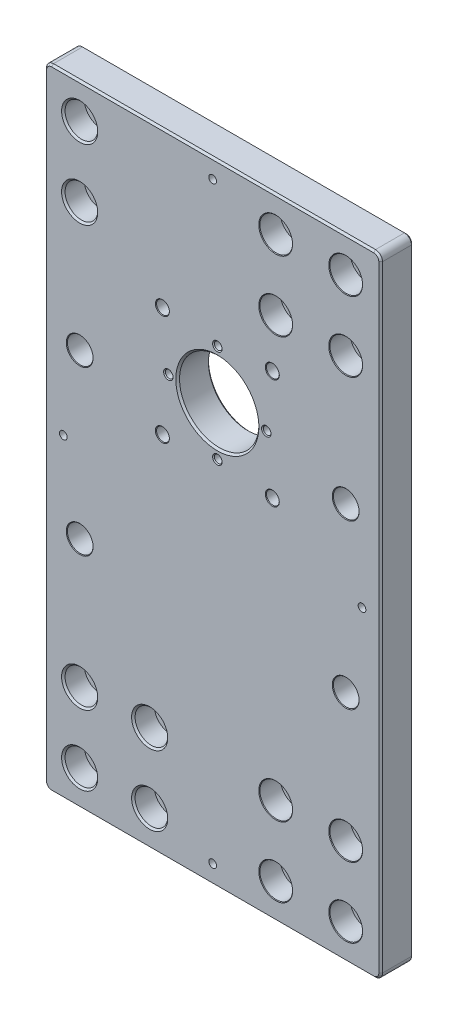
from build123d import *

# Parameters (mm, degrees)
SKETCH1_W                                     = 144
SKETCH1_H                                     = 270
SKETCH1_R                                     = 17
BASE_FLANGE1_DEPTH                            = 14
CBORE_FOR_M8_HEX_SOCKET_HEAD_CAP_SCR_2_COUNT  = 2
CBORE_FOR_M8_HEX_SOCKET_HEAD_CAP_SCR_2_PITCH  = 30
CBORE_FOR_M8_HEX_SOCKET_HEAD_CAP_SCR_3_COUNT  = 2
CBORE_FOR_M8_HEX_SOCKET_HEAD_CAP_SCR_3_PITCH  = 42.426406871
CBORE_FOR_M8_HEX_SOCKET_HEAD_CAP_SCR_4_COUNT  = 2
CBORE_FOR_M8_HEX_SOCKET_HEAD_CAP_SCR_4_PITCH  = 30
CBORE_FOR_M8_HEX_SOCKET_HEAD_CAP_SCR_5_COUNT  = 2
CBORE_FOR_M8_HEX_SOCKET_HEAD_CAP_SCR_5_PITCH  = 241.867732449
CBORE_FOR_M8_HEX_SOCKET_HEAD_CAP_SCR_6_COUNT  = 2
CBORE_FOR_M8_HEX_SOCKET_HEAD_CAP_SCR_6_PITCH  = 240
CBORE_FOR_M8_HEX_SOCKET_HEAD_CAP_SCR_7_COUNT  = 2
CBORE_FOR_M8_HEX_SOCKET_HEAD_CAP_SCR_7_PITCH  = 212.132034356
CBORE_FOR_M8_HEX_SOCKET_HEAD_CAP_SCR_8_COUNT  = 2
CBORE_FOR_M8_HEX_SOCKET_HEAD_CAP_SCR_8_PITCH  = 210
M4_TAPPED_HOLE1_D                             = 3.3
M4_TAPPED_HOLE1_CSINK_D                       = 4.05
M4_TAPPED_HOLE1_CSINK_ANGLE                   = 90
M5_CLEARANCE_HOLE1_AT_2_COUNT                 = 2
M5_CLEARANCE_HOLE1_AT_2_PITCH                 = 47.100382695
M5_CLEARANCE_HOLE1_AT_3_COUNT                 = 2
M5_CLEARANCE_HOLE1_AT_3_PITCH                 = 66.61
M5_CLEARANCE_HOLE1_AT_4_COUNT                 = 2
M5_CLEARANCE_HOLE1_AT_4_PITCH                 = 47.100382695
CBORE_FOR_M6_HEX_SOCKET_HEAD_CAP_SCR_2_COUNT  = 2
CBORE_FOR_M6_HEX_SOCKET_HEAD_CAP_SCR_2_PITCH  = 114
CRVPATTERN1_COUNT                             = 2
CRVPATTERN1_PITCH                             = 70
M4_TAPPED_HOLE2_AT_2_COUNT                    = 2
M4_TAPPED_HOLE2_AT_2_PITCH                    = 142.214626533
M4_TAPPED_HOLE2_AT_3_COUNT                    = 2
M4_TAPPED_HOLE2_AT_3_PITCH                    = 254
M4_TAPPED_HOLE2_AT_4_COUNT                    = 2
M4_TAPPED_HOLE2_AT_4_PITCH                    = 142.214626533
CBORE_FOR_M8_HEX_SOCKET_HEAD_CAP_SCR_9_COUNT  = 2
CBORE_FOR_M8_HEX_SOCKET_HEAD_CAP_SCR_9_PITCH  = 30
CBORE_FOR_M8_HEX_SOCKET_HEAD_CAP_SCR_10_COUNT = 2
CBORE_FOR_M8_HEX_SOCKET_HEAD_CAP_SCR_10_PITCH = 210
CBORE_FOR_M8_HEX_SOCKET_HEAD_CAP_SCR_11_COUNT = 2
CBORE_FOR_M8_HEX_SOCKET_HEAD_CAP_SCR_11_PITCH = 240
CBORE_FOR_M8_HEX_SOCKET_HEAD_CAP_SCR_12_COUNT = 2
CBORE_FOR_M8_HEX_SOCKET_HEAD_CAP_SCR_12_PITCH = 212.132034356
CBORE_FOR_M8_HEX_SOCKET_HEAD_CAP_SCR_13_COUNT = 2
CBORE_FOR_M8_HEX_SOCKET_HEAD_CAP_SCR_13_PITCH = 241.867732449
FILLET1_R                                     = 3
CHAMFER1_SIZE                                 = 0.8


# Sheet-metal steps are written as plain solids
with BuildPart() as part:
    # Sketch1 → Base-Flange1 (new body)
    with BuildSketch(Plane.XY):
        with Locations((-72, -135)):
            Rectangle(SKETCH1_W, SKETCH1_H)
        with Locations(Location((-70, -90, 0), (0, 0, 180))):
            Circle(SKETCH1_R, mode=Mode.SUBTRACT)
    extrude(amount=-BASE_FLANGE1_DEPTH)

    # Sketch7 → CBORE for M8 Hex Socket Head Cap Screw1 (revolve, cut)
    with BuildSketch(Plane(origin=(-45, -15, 0), x_dir=(0, -1, 0), z_dir=(1, 0, 0))):
        Polygon((0, 0), (0, 14), (4.75, 14), (4.25, 13.5), (4.25, 9), (7, 9), (7, 0.25), (7.25, 0), align=None)
    cbore_for_m8_hex_socket_head_cap_screw1 = revolve(axis=Axis((-45, -15, 6.35), (0, 0, -1)), mode=Mode.SUBTRACT)

    # CBORE for M8 Hex Socket Head Cap Scr 2: CBORE for M8 Hex Socket Head Cap Screw1 ×2
    with Locations(*[(i * CBORE_FOR_M8_HEX_SOCKET_HEAD_CAP_SCR_2_PITCH, 0, 0) for i in range(1, CBORE_FOR_M8_HEX_SOCKET_HEAD_CAP_SCR_2_COUNT)]):
        add(cbore_for_m8_hex_socket_head_cap_screw1, mode=Mode.SUBTRACT)

    # CBORE for M8 Hex Socket Head Cap Scr 3: CBORE for M8 Hex Socket Head Cap Screw1 ×2
    with Locations(*[Vector(0.7071067811865476, -0.7071067811865475, 0) * (i * CBORE_FOR_M8_HEX_SOCKET_HEAD_CAP_SCR_3_PITCH) for i in range(1, CBORE_FOR_M8_HEX_SOCKET_HEAD_CAP_SCR_3_COUNT)]):
        add(cbore_for_m8_hex_socket_head_cap_screw1, mode=Mode.SUBTRACT)

    # CBORE for M8 Hex Socket Head Cap Scr 4: CBORE for M8 Hex Socket Head Cap Screw1 ×2
    with Locations(*[(0, -i * CBORE_FOR_M8_HEX_SOCKET_HEAD_CAP_SCR_4_PITCH, 0) for i in range(1, CBORE_FOR_M8_HEX_SOCKET_HEAD_CAP_SCR_4_COUNT)]):
        add(cbore_for_m8_hex_socket_head_cap_screw1, mode=Mode.SUBTRACT)

    # CBORE for M8 Hex Socket Head Cap Scr 5: CBORE for M8 Hex Socket Head Cap Screw1 ×2
    with Locations(*[Vector(0.12403473458920848, -0.9922778767136676, 0) * (i * CBORE_FOR_M8_HEX_SOCKET_HEAD_CAP_SCR_5_PITCH) for i in range(1, CBORE_FOR_M8_HEX_SOCKET_HEAD_CAP_SCR_5_COUNT)]):
        add(cbore_for_m8_hex_socket_head_cap_screw1, mode=Mode.SUBTRACT)

    # CBORE for M8 Hex Socket Head Cap Scr 6: CBORE for M8 Hex Socket Head Cap Screw1 ×2
    with Locations(*[(0, -i * CBORE_FOR_M8_HEX_SOCKET_HEAD_CAP_SCR_6_PITCH, 0) for i in range(1, CBORE_FOR_M8_HEX_SOCKET_HEAD_CAP_SCR_6_COUNT)]):
        add(cbore_for_m8_hex_socket_head_cap_screw1, mode=Mode.SUBTRACT)

    # CBORE for M8 Hex Socket Head Cap Scr 7: CBORE for M8 Hex Socket Head Cap Screw1 ×2
    with Locations(*[Vector(0.1414213562373096, -0.9899494936611666, 0) * (i * CBORE_FOR_M8_HEX_SOCKET_HEAD_CAP_SCR_7_PITCH) for i in range(1, CBORE_FOR_M8_HEX_SOCKET_HEAD_CAP_SCR_7_COUNT)]):
        add(cbore_for_m8_hex_socket_head_cap_screw1, mode=Mode.SUBTRACT)

    # CBORE for M8 Hex Socket Head Cap Scr 8: CBORE for M8 Hex Socket Head Cap Screw1 ×2
    with Locations(*[(0, -i * CBORE_FOR_M8_HEX_SOCKET_HEAD_CAP_SCR_8_PITCH, 0) for i in range(1, CBORE_FOR_M8_HEX_SOCKET_HEAD_CAP_SCR_8_COUNT)]):
        add(cbore_for_m8_hex_socket_head_cap_screw1, mode=Mode.SUBTRACT)

    # M4 Tapped Hole1 (through all)
    with Locations(Plane.XY):
        with Locations((-91, -90), (-70, -69), (-49, -90), (-70, -111)):
            CounterSinkHole(M4_TAPPED_HOLE1_D / 2, M4_TAPPED_HOLE1_CSINK_D / 2, counter_sink_angle=M4_TAPPED_HOLE1_CSINK_ANGLE)

    # Sketch16 → M5 Clearance Hole1 (revolve, cut)
    with BuildSketch(Plane(origin=(-93.550191347, -113.550191347, 0), x_dir=(0, -1, 0), z_dir=(1, 0, 0))):
        Polygon((0, 0), (0, 14), (3, 14), (2.75, 13.75), (2.75, 0.25), (3, 0), align=None)
    m5_clearance_hole1 = revolve(axis=Axis((-93.550191347, -113.550191347, 6.35), (0, 0, -1)), mode=Mode.SUBTRACT)

    # M5 Clearance Hole1 at 2: M5 Clearance Hole1 ×2
    with Locations(*[(0, i * M5_CLEARANCE_HOLE1_AT_2_PITCH, 0) for i in range(1, M5_CLEARANCE_HOLE1_AT_2_COUNT)]):
        add(m5_clearance_hole1, mode=Mode.SUBTRACT)

    # M5 Clearance Hole1 at 3: M5 Clearance Hole1 ×2
    with Locations(*[Vector(0.707106781186551, 0.707106781186544, 0) * (i * M5_CLEARANCE_HOLE1_AT_3_PITCH) for i in range(1, M5_CLEARANCE_HOLE1_AT_3_COUNT)]):
        add(m5_clearance_hole1, mode=Mode.SUBTRACT)

    # M5 Clearance Hole1 at 4: M5 Clearance Hole1 ×2
    with Locations(*[(i * M5_CLEARANCE_HOLE1_AT_4_PITCH, 0, 0) for i in range(1, M5_CLEARANCE_HOLE1_AT_4_COUNT)]):
        add(m5_clearance_hole1, mode=Mode.SUBTRACT)

    # Sketch20 → CBORE for M6 Hex Socket Head Cap Screw1 (revolve, cut)
    with BuildSketch(Plane(origin=(-129, -100, 0), x_dir=(0, -1, 0), z_dir=(1, 0, 0))):
        Polygon((0, 0), (0, 14), (3.5, 14), (3.25, 13.75), (3.25, 8), (5.5, 8), (5.5, 0.25), (5.75, 0), align=None)
    cbore_for_m6_hex_socket_head_cap_screw1 = revolve(axis=Axis((-129, -100, 6.35), (0, 0, -1)), mode=Mode.SUBTRACT)

    # CBORE for M6 Hex Socket Head Cap Scr 2: CBORE for M6 Hex Socket Head Cap Screw1 ×2
    with Locations(*[(i * CBORE_FOR_M6_HEX_SOCKET_HEAD_CAP_SCR_2_PITCH, 0, 0) for i in range(1, CBORE_FOR_M6_HEX_SOCKET_HEAD_CAP_SCR_2_COUNT)]):
        add(cbore_for_m6_hex_socket_head_cap_screw1, mode=Mode.SUBTRACT)

    # CrvPattern1: CBORE for M6 Hex Socket Head Cap Screw1 ×2
    with Locations(*[(0, -i * CRVPATTERN1_PITCH, 0) for i in range(1, CRVPATTERN1_COUNT)]):
        add(cbore_for_m6_hex_socket_head_cap_screw1, mode=Mode.SUBTRACT)

    # CrvPattern1 copy 1 sketch → CrvPattern1 copy 1 (revolve, cut)
    with BuildSketch(Plane(origin=(-15, -170, 0), x_dir=(0, -1, 0), z_dir=(1, 0, 0))):
        Polygon((0, 0), (0, 14), (3.5, 14), (3.25, 13.75), (3.25, 8), (5.5, 8), (5.5, 0.25), (5.75, 0), align=None)
    revolve(axis=Axis((-15, -170, 6.35), (0, 0, -1)), mode=Mode.SUBTRACT)

    # Sketch26 → M4 Tapped Hole2 (revolve, cut)
    with BuildSketch(Plane(origin=(-72, -8, 0), x_dir=(0, -1, 0), z_dir=(1, 0, 0))):
        Polygon((0, 0), (0, 14), (2.025, 14), (1.65, 13.625), (1.65, 0), align=None)
    m4_tapped_hole2 = revolve(axis=Axis((-72, -8, 6.35), (0, 0, -1)), mode=Mode.SUBTRACT)

    # M4 Tapped Hole2 at 2: M4 Tapped Hole2 ×2
    with Locations(*[Vector(-0.45002403451816303, -0.8930164434969803, 0) * (i * M4_TAPPED_HOLE2_AT_2_PITCH) for i in range(1, M4_TAPPED_HOLE2_AT_2_COUNT)]):
        add(m4_tapped_hole2, mode=Mode.SUBTRACT)

    # M4 Tapped Hole2 at 3: M4 Tapped Hole2 ×2
    with Locations(*[(0, -i * M4_TAPPED_HOLE2_AT_3_PITCH, 0) for i in range(1, M4_TAPPED_HOLE2_AT_3_COUNT)]):
        add(m4_tapped_hole2, mode=Mode.SUBTRACT)

    # M4 Tapped Hole2 at 4: M4 Tapped Hole2 ×2
    with Locations(*[Vector(0.4500240345181632, -0.8930164434969802, 0) * (i * M4_TAPPED_HOLE2_AT_4_PITCH) for i in range(1, M4_TAPPED_HOLE2_AT_4_COUNT)]):
        add(m4_tapped_hole2, mode=Mode.SUBTRACT)

    # Sketch28 → CBORE for M8 Hex Socket Head Cap Screw2 (revolve, cut)
    with BuildSketch(Plane(origin=(-129, -15, 0), x_dir=(0, -1, 0), z_dir=(1, 0, 0))):
        Polygon((0, 0), (0, 14), (4.75, 14), (4.25, 13.5), (4.25, 9), (7, 9), (7, 0.75), (7.75, 0), align=None)
    cbore_for_m8_hex_socket_head_cap_screw2 = revolve(axis=Axis((-129, -15, 6.35), (0, 0, -1)), mode=Mode.SUBTRACT)

    # CBORE for M8 Hex Socket Head Cap Scr 9: CBORE for M8 Hex Socket Head Cap Screw2 ×2
    with Locations(*[(0, -i * CBORE_FOR_M8_HEX_SOCKET_HEAD_CAP_SCR_9_PITCH, 0) for i in range(1, CBORE_FOR_M8_HEX_SOCKET_HEAD_CAP_SCR_9_COUNT)]):
        add(cbore_for_m8_hex_socket_head_cap_screw2, mode=Mode.SUBTRACT)

    # CBORE for M8 Hex Socket Head Cap Scr 10: CBORE for M8 Hex Socket Head Cap Screw2 ×2
    with Locations(*[(0, -i * CBORE_FOR_M8_HEX_SOCKET_HEAD_CAP_SCR_10_PITCH, 0) for i in range(1, CBORE_FOR_M8_HEX_SOCKET_HEAD_CAP_SCR_10_COUNT)]):
        add(cbore_for_m8_hex_socket_head_cap_screw2, mode=Mode.SUBTRACT)

    # CBORE for M8 Hex Socket Head Cap Scr 11: CBORE for M8 Hex Socket Head Cap Screw2 ×2
    with Locations(*[(0, -i * CBORE_FOR_M8_HEX_SOCKET_HEAD_CAP_SCR_11_PITCH, 0) for i in range(1, CBORE_FOR_M8_HEX_SOCKET_HEAD_CAP_SCR_11_COUNT)]):
        add(cbore_for_m8_hex_socket_head_cap_screw2, mode=Mode.SUBTRACT)

    # CBORE for M8 Hex Socket Head Cap Scr 12: CBORE for M8 Hex Socket Head Cap Screw2 ×2
    with Locations(*[Vector(0.14142135623730956, -0.9899494936611666, 0) * (i * CBORE_FOR_M8_HEX_SOCKET_HEAD_CAP_SCR_12_PITCH) for i in range(1, CBORE_FOR_M8_HEX_SOCKET_HEAD_CAP_SCR_12_COUNT)]):
        add(cbore_for_m8_hex_socket_head_cap_screw2, mode=Mode.SUBTRACT)

    # CBORE for M8 Hex Socket Head Cap Scr 13: CBORE for M8 Hex Socket Head Cap Screw2 ×2
    with Locations(*[Vector(0.12403473458920847, -0.9922778767136677, 0) * (i * CBORE_FOR_M8_HEX_SOCKET_HEAD_CAP_SCR_13_PITCH) for i in range(1, CBORE_FOR_M8_HEX_SOCKET_HEAD_CAP_SCR_13_COUNT)]):
        add(cbore_for_m8_hex_socket_head_cap_screw2, mode=Mode.SUBTRACT)

    # Fillet1
    fillet1_edges = [part.edges().sort_by_distance(p)[0] for p in [
        (0, 0, -7),
        (0, -270, -7),
        (-144, -270, -7),
        (-144, 0, -7),
    ]]
    fillet(fillet1_edges, radius=FILLET1_R)

    # Chamfer1
    chamfer1_edges = [part.edges().sort_by_distance(p)[0] for p in [
        (-53, -90, -14),
        (-53, -90, 0),
        (-72, -270, 0),
        (-72, -270, -14),
        (-72, 0, 0),
        (-144, -135, 0),
        (0, -135, 0),
        (-143.121320344, -0.878679656, 0),
        (-143.121320344, -269.121320344, 0),
        (-0.878679656, -0.878679656, 0),
        (-0.878679656, -269.121320344, 0),
        (0, -135, -14),
        (-72, 0, -14),
        (-144, -135, -14),
        (-143.121320344, -0.878679656, -14),
        (-143.121320344, -269.121320344, -14),
        (-0.878679656, -0.878679656, -14),
        (-0.878679656, -269.121320344, -14),
    ]]
    chamfer(chamfer1_edges, length=CHAMFER1_SIZE)


solid = part.part
